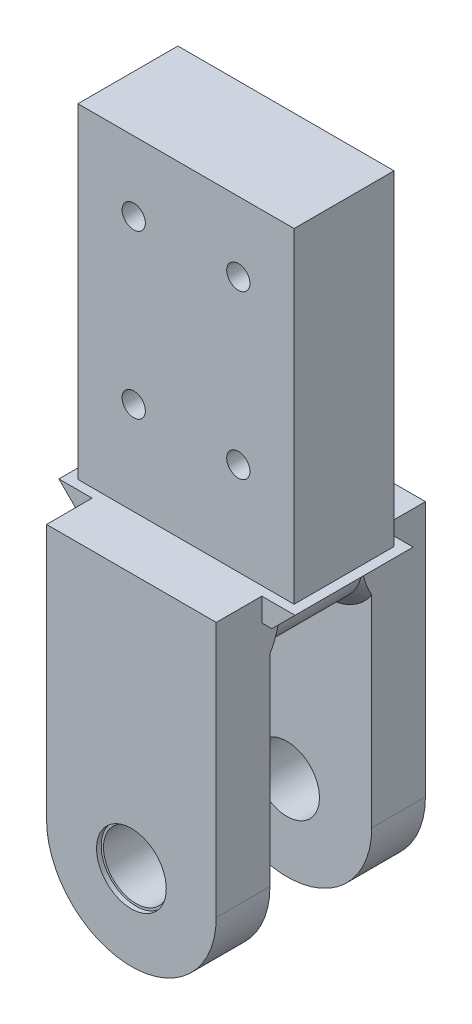
from build123d import *

# Parameters (mm, degrees)
SKETCH1_R           = 7
SKETCH1_R_2         = 2.5
BOSS_EXTRUDE1_DEPTH = 22.5
SKETCH2_W           = 21.9
SKETCH2_H           = 63.25
CUT_EXTRUDE1_DEPTH  = 136.25346576
SKETCH3_R           = 7.5
CUT_EXTRUDE2_DEPTH  = 1
CUT_EXTRUDE3_START  = -1
SKETCH4_R           = 7.5
CUT_EXTRUDE3_DEPTH  = 1
SKETCH5_W           = 9.8
SKETCH5_H           = 70
CUT_EXTRUDE4_DEPTH  = 136.25346576
CUT_EXTRUDE5_DEPTH  = 135.872393395
CUT_EXTRUDE6_REACH  = 148.858
SKETCH8_W           = 46.5
SKETCH8_H           = 1.95
SKETCH9_W           = 50.8
SKETCH9_H           = 25.4
BOSS_EXTRUDE2_DEPTH = 5
FILLET1_R           = 10
CHAMFER1_SIZE       = 5
CHAMFER2_SIZE       = 2


# Some blends are built 0.0001 mm under size
with BuildPart() as part:
    # Sketch1 → Boss-Extrude1 (new, symmetric)
    with BuildSketch(Plane.XY):
        with BuildLine():
            Line((-23.25, 0), (-23.25, 125))
            Line((-23.25, 125), (23.25, 125))
            Line((23.25, 125), (23.25, 0))
            ThreePointArc((23.25, 0), (0, -23.25), (-23.25, 0))
        make_face()
        with Locations(Location((0, 0, 0), (0, 0, 180))):
            Circle(SKETCH1_R, mode=Mode.SUBTRACT)
        with Locations(Location((-11.25, 110, 0), (0, 0, 180))):
            Circle(SKETCH1_R_2, mode=Mode.SUBTRACT)
        with Locations(Location((11.25, 110, 0), (0, 0, 180))):
            Circle(SKETCH1_R_2, mode=Mode.SUBTRACT)
        with Locations(Location((11.25, 75, 0), (0, 0, 180))):
            Circle(SKETCH1_R_2, mode=Mode.SUBTRACT)
        with Locations(Location((-11.25, 75, 0), (0, 0, 180))):
            Circle(SKETCH1_R_2, mode=Mode.SUBTRACT)
    extrude(amount=BOSS_EXTRUDE1_DEPTH, both=True)

    # Sketch2 → Cut-Extrude1 (cut, through all)
    with BuildSketch(Plane(origin=(23.25, 0, 0), x_dir=(0, 0, -1), z_dir=(1, 0, 0))):
        with Locations((0, 8.375)):
            Rectangle(SKETCH2_W, SKETCH2_H)
    extrude(amount=-CUT_EXTRUDE1_DEPTH, mode=Mode.SUBTRACT)

    # Sketch3 → Cut-Extrude2 (cut)
    with BuildSketch(Plane.XY.offset(22.5)):
        Circle(SKETCH3_R)
    extrude(amount=-CUT_EXTRUDE2_DEPTH, mode=Mode.SUBTRACT)

    # Sketch4 → Cut-Extrude3 (cut)
    with BuildSketch(Plane(origin=(0, 0, -22.5), x_dir=(-1, 0, 0), z_dir=(0, 0, -1)).offset(CUT_EXTRUDE3_START)):
        with Locations(Location((0, 0, 0), (0, 0, 180))):
            Circle(SKETCH4_R)
    extrude(amount=CUT_EXTRUDE3_DEPTH, mode=Mode.SUBTRACT)

    # Sketch5 → Cut-Extrude4 (cut, through all)
    with BuildSketch(Plane(origin=(23.25, 0, 0), x_dir=(0, 0, -1), z_dir=(1, 0, 0))):
        with Locations((-17.6, 90)):
            Rectangle(SKETCH5_W, SKETCH5_H)
        with Locations((17.6, 90)):
            Rectangle(SKETCH5_W, SKETCH5_H)
    extrude(amount=-CUT_EXTRUDE4_DEPTH, mode=Mode.SUBTRACT)

    # Sketch6 → Cut-Extrude5 (cut, through all)
    with BuildSketch(Plane.XY.offset(22.5)):
        with BuildLine():
            Line((-18.25, 0), (-18.25, 55))
            Line((-18.25, 55), (-23.25, 55))
            Line((-23.25, 55), (-23.25, -23.25))
            Line((-23.25, -23.25), (23.25, -23.25))
            Line((23.25, -23.25), (23.25, 55))
            Line((23.25, 55), (18.25, 55))
            Line((18.25, 55), (18.25, 0))
            ThreePointArc((18.25, 0), (0, -18.25), (-18.25, 0))
        make_face()
    extrude(amount=-CUT_EXTRUDE5_DEPTH, mode=Mode.SUBTRACT)

    # Cut-Extrude6: up to this face of the body (flat: up to its plane)
    cut_extrude6_end = Plane(part.part.faces().sort_by_distance((0, 55, -17.6))[0])
    # Sketch8 → Cut-Extrude6 (cut, up to the picked face)
    with BuildSketch(Plane(origin=(0, 125, 0), x_dir=(1, 0, 0), z_dir=(0, 1, 0)), mode=Mode.PRIVATE) as cut_extrude6_sk1:
        with Locations((0, 11.725)):
            Rectangle(SKETCH8_W, SKETCH8_H)
    cut_extrude6_tool1 = split(extrude(cut_extrude6_sk1.sketch, amount=-CUT_EXTRUDE6_REACH, mode=Mode.PRIVATE), bisect_by=cut_extrude6_end, keep=Keep.BOTH, mode=Mode.PRIVATE)
    # Sketch8 → Cut-Extrude6 (cut, up to the picked face)
    with BuildSketch(Plane(origin=(0, 125, 0), x_dir=(1, 0, 0), z_dir=(0, 1, 0)), mode=Mode.PRIVATE) as cut_extrude6_sk2:
        with Locations((0, -11.725)):
            Rectangle(SKETCH8_W, SKETCH8_H)
    cut_extrude6_tool2 = split(extrude(cut_extrude6_sk2.sketch, amount=-CUT_EXTRUDE6_REACH, mode=Mode.PRIVATE), bisect_by=cut_extrude6_end, keep=Keep.BOTH, mode=Mode.PRIVATE)
    add(cut_extrude6_tool1.solids().sort_by(Axis((0, 125, -11.725), (0, -1, 0)))[0], mode=Mode.SUBTRACT)
    add(cut_extrude6_tool2.solids().sort_by(Axis((0, 125, 11.725), (0, -1, 0)))[0], mode=Mode.SUBTRACT)

    # Sketch9 → Boss-Extrude2 (add)
    with BuildSketch(Plane(origin=(0, 55, 0), x_dir=(1, 0, 0), z_dir=(0, 1, 0))):
        Rectangle(SKETCH9_W, SKETCH9_H)
    extrude(amount=-BOSS_EXTRUDE2_DEPTH)

    # Fillet1
    fillet1_edges = [part.edges().sort_by_distance(p)[0] for p in [
        (18.25, 40, 0),
        (-18.25, 40, 0),
    ]]
    fillet(fillet1_edges, radius=FILLET1_R - 0.0001)  # a hair under: the kernel refuses the full size

    # Chamfer1
    chamfer1_edges = [part.edges().sort_by_distance(p)[0] for p in [
        (-25.4, 50, 0),
        (25.4, 50, 0),
    ]]
    chamfer(chamfer1_edges, length=CHAMFER1_SIZE - 0.0001)  # a hair under: the kernel refuses the full size

    # Chamfer2
    # the kernel refuses this chamfer: 2 mm, written as the material it adds along each edge
    with BuildSketch(Plane(origin=(8.2501, 40, -10.95), x_dir=(0, -0.9996219169112968, -0.02749587661058651), z_dir=(-1, 0, 0))) as chamfer2_piece_1:
        Polygon((CHAMFER2_SIZE * 0.999621916911, CHAMFER2_SIZE * 0.0274958766106), (-CHAMFER2_SIZE * 0.0274958766106, CHAMFER2_SIZE * 0.999621916911), (0, 0), align=None)
    extrude(amount=16.5002)
    with BuildSketch(Plane(origin=(8.2501, 40, 10.95), x_dir=(0, -0.9996219169112968, 0.02749587661058651), z_dir=(-1, 0, 0))) as chamfer2_piece_2:
        Polygon((CHAMFER2_SIZE * 0.999621916911, -CHAMFER2_SIZE * 0.0274958766106), (-CHAMFER2_SIZE * 0.0274958766106, -CHAMFER2_SIZE * 0.999621916911), (0, 0), align=None)
    extrude(amount=16.5002)
    with BuildSketch(Plane(origin=(8.2501, 49.9999, 10.95), x_dir=(0, -1, 0), z_dir=(-1, 0, 0))) as chamfer2_piece_3_section:
        Polygon((9.9999 + CHAMFER2_SIZE, 0), (9.9999, -CHAMFER2_SIZE), (9.9999, 0), align=None)
    chamfer2_piece_3 = revolve(axis=Axis((8.2501, 49.9999, 10.95), (0, 0, 1)), revolution_arc=119.48144917, mode=Mode.PRIVATE)
    chamfer2_piece_3 = split(chamfer2_piece_3, bisect_by=Plane(origin=(18.25, 39.233435125, 10.852733076), z_dir=(-1, 0, 0)), keep=Keep.TOP, mode=Mode.PRIVATE)
    chamfer2_piece_3 = split(chamfer2_piece_3, bisect_by=Plane(origin=(10.698789492, 50, 10.852733076), z_dir=(0, -1, 0)), keep=Keep.TOP, mode=Mode.PRIVATE)
    add(chamfer2_piece_3)
    with BuildSketch(Plane(origin=(8.2501, 49.9999, -10.95), x_dir=(0, -1, 0), z_dir=(-1, 0, 0))) as chamfer2_piece_4_section:
        Polygon((9.9999 + CHAMFER2_SIZE, 0), (9.9999, CHAMFER2_SIZE), (9.9999, 0), align=None)
    chamfer2_piece_4 = revolve(axis=Axis((8.2501, 49.9999, -10.95), (0, 0, 1)), revolution_arc=119.48144917, mode=Mode.PRIVATE)
    chamfer2_piece_4 = split(chamfer2_piece_4, bisect_by=Plane(origin=(18.25, 39.233435125, -10.852733076), z_dir=(-1, 0, 0)), keep=Keep.TOP, mode=Mode.PRIVATE)
    chamfer2_piece_4 = split(chamfer2_piece_4, bisect_by=Plane(origin=(10.698789492, 50, -10.852733076), z_dir=(0, -1, 0)), keep=Keep.TOP, mode=Mode.PRIVATE)
    add(chamfer2_piece_4)
    with BuildSketch(Plane(origin=(-8.2501, 49.9999, -10.95), x_dir=(0, -1, 0), z_dir=(1, 0, 0))) as chamfer2_piece_5_section:
        Polygon((9.9999 + CHAMFER2_SIZE, 0), (9.9999, -CHAMFER2_SIZE), (9.9999, 0), align=None)
    chamfer2_piece_5 = revolve(axis=Axis((-8.2501, 49.9999, -10.95), (0, 0, -1)), revolution_arc=119.48144917, mode=Mode.PRIVATE)
    chamfer2_piece_5 = split(chamfer2_piece_5, bisect_by=Plane(origin=(-10.698789492, 50, -10.852733076), z_dir=(0, -1, 0)), keep=Keep.TOP, mode=Mode.PRIVATE)
    chamfer2_piece_5 = split(chamfer2_piece_5, bisect_by=Plane(origin=(-18.25, 39.233435125, -10.852733076), z_dir=(1, 0, 0)), keep=Keep.TOP, mode=Mode.PRIVATE)
    add(chamfer2_piece_5)
    with BuildSketch(Plane(origin=(-8.2501, 49.9999, 10.95), x_dir=(0, -1, 0), z_dir=(1, 0, 0))) as chamfer2_piece_6_section:
        Polygon((9.9999 + CHAMFER2_SIZE, 0), (9.9999, CHAMFER2_SIZE), (9.9999, 0), align=None)
    chamfer2_piece_6 = revolve(axis=Axis((-8.2501, 49.9999, 10.95), (0, 0, -1)), revolution_arc=119.48144917, mode=Mode.PRIVATE)
    chamfer2_piece_6 = split(chamfer2_piece_6, bisect_by=Plane(origin=(-10.698789492, 50, 10.852733076), z_dir=(0, -1, 0)), keep=Keep.TOP, mode=Mode.PRIVATE)
    chamfer2_piece_6 = split(chamfer2_piece_6, bisect_by=Plane(origin=(-18.25, 39.233435125, 10.852733076), z_dir=(1, 0, 0)), keep=Keep.TOP, mode=Mode.PRIVATE)
    add(chamfer2_piece_6)


solid = part.part
